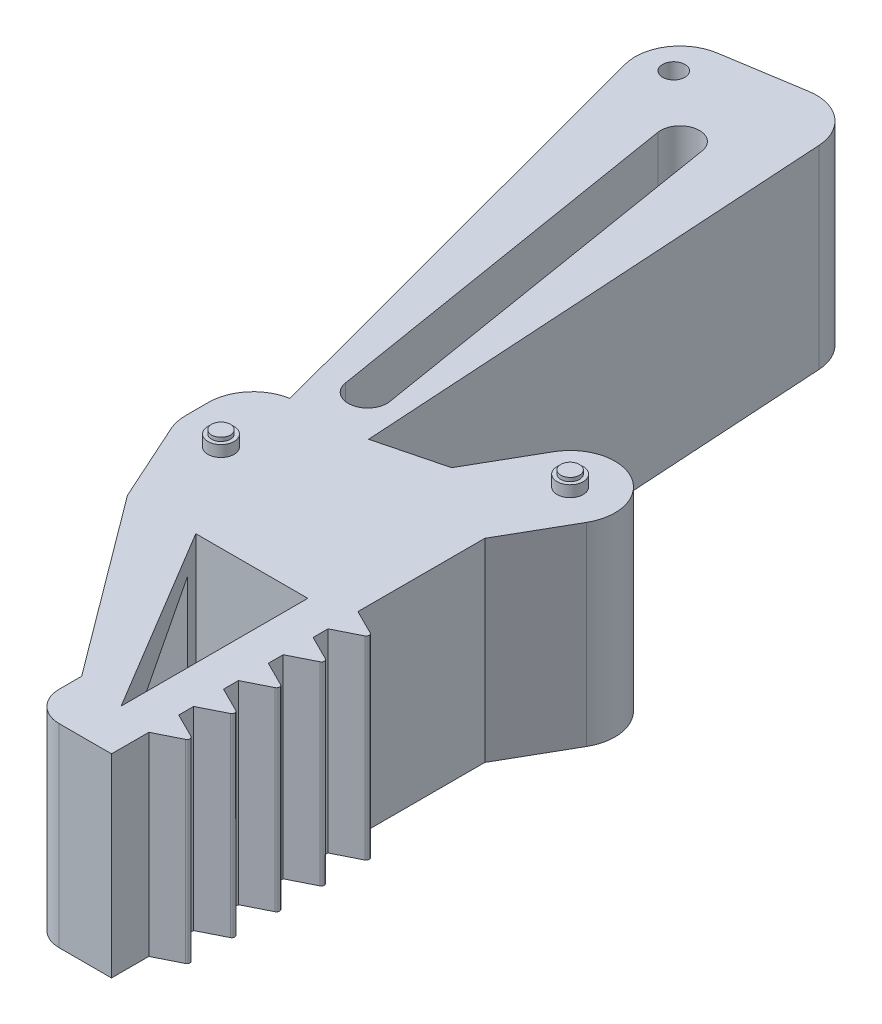
from build123d import *

# Parameters (mm, degrees)
BOSS_EXTRUDE1_DEPTH = 13
CUT_EXTRUDE1_DEPTH  = 26
BOSS_EXTRUDE3_DEPTH = 26
LPATTERN1_COUNT     = 5
LPATTERN1_PITCH     = 6
FILLET1_R           = 6
FILLET2_R           = 0.4
FILLET3_R           = 0.4
FILLET4_R           = 0.4
FILLET5_R           = 0.4
FILLET6_R           = 0.4
FILLET7_R           = 6
FILLET8_R           = 4
SKETCH4_R           = 1.5
CUT_EXTRUDE2_DEPTH  = 26
CUT_EXTRUDE3_DEPTH  = 7
SKETCH6_R           = 1.75
BOSS_EXTRUDE4_DEPTH = 1.5
SKETCH7_R           = 1.25
BOSS_EXTRUDE5_DEPTH = 0.5
CUT_EXTRUDE7_DEPTH  = 10


with BuildPart() as part:
    # Sketch1 → Boss-Extrude1 (new, symmetric)
    with BuildSketch(Plane(origin=(0, 0, 0), x_dir=(1, 0, 0), z_dir=(0, 1, 0))):
        Polygon((-26.537476469, 34.756624027), (-8.502257827, -32.880132907), (1.497742173, -32.349622066), (-2.834075277, 38.51810936), align=None)
        with BuildLine():
            Line((20.769613605, -36.051991051), (25.741983559, -27.375843459))
            ThreePointArc((25.741983559, -27.375843459), (23.519716976, -19.186732931), (15.330606448, -21.408999514))
            Line((15.330606448, -21.408999514), (10.358236494, -30.085147107))
            Line((10.358236494, -30.085147107), (1.497742173, -32.349622066))
            Line((1.497742173, -32.349622066), (-13.502257827, -33.145388327))
            Line((-13.502257827, -33.145388327), (-13.502257827, -43.145388327))
            Line((-13.502257827, -43.145388327), (-8.151905345, -54.993330272))
            Line((-8.151905345, -54.993330272), (9.769613605, -79.051991051))
            Line((9.769613605, -79.051991051), (9.769613605, -86.051991051))
            Line((9.769613605, -86.051991051), (20.769613605, -86.051991051))
            Line((20.769613605, -86.051991051), (20.769613605, -36.051991051))
        make_face()
    extrude(amount=BOSS_EXTRUDE1_DEPTH, both=True)

    # Sketch2 → Cut-Extrude1 (cut)
    with BuildSketch(Plane(origin=(0, 13, 0), x_dir=(1, 0, 0), z_dir=(0, 1, 0))):
        Polygon((0.878679347, -54.871314491), (15.878679347, -54.871314491), (15.878679347, -79.871314491), align=None)
    extrude(amount=-CUT_EXTRUDE1_DEPTH, mode=Mode.SUBTRACT)

    # Sketch3 → Boss-Extrude3 (add)
    with BuildSketch(Plane(origin=(0, 13, 0), x_dir=(1, 0, 0), z_dir=(0, 1, 0))):
        Polygon((20.769613605, -77.051991051), (20.769613605, -79.051991051), (24.769613605, -79.051991051), align=None)
        Polygon((20.769613605, -79.051991051), (20.769613605, -81.051991051), (24.769613605, -79.051991051), align=None)
    boss_extrude3 = extrude(amount=-BOSS_EXTRUDE3_DEPTH)

    # LPattern1: Boss-Extrude3 ×5
    with Locations(*[(0, 0, -i * LPATTERN1_PITCH) for i in range(1, LPATTERN1_COUNT)]):
        add(boss_extrude3)

    # Fillet1
    fillet1_edges = [part.edges().sort_by_distance(p)[0] for p in [
        (-26.537476469, 0, -34.756624027),
        (-2.834075277, 0, -38.51810936),
    ]]
    fillet(fillet1_edges, radius=FILLET1_R)

    # Fillet2
    fillet2_edges = [part.edges().sort_by_distance(p)[0] for p in [
        (24.769613605, 0, 79.051991051),
    ]]
    fillet(fillet2_edges, radius=FILLET2_R)

    # Fillet3
    fillet3_edges = [part.edges().sort_by_distance(p)[0] for p in [
        (24.769613605, 0, 73.051991051),
    ]]
    fillet(fillet3_edges, radius=FILLET3_R)

    # Fillet4
    fillet4_edges = [part.edges().sort_by_distance(p)[0] for p in [
        (24.769613605, 0, 67.051991051),
    ]]
    fillet(fillet4_edges, radius=FILLET4_R)

    # Fillet5
    fillet5_edges = [part.edges().sort_by_distance(p)[0] for p in [
        (24.769613605, 0, 61.051991051),
    ]]
    fillet(fillet5_edges, radius=FILLET5_R)

    # Fillet6
    fillet6_edges = [part.edges().sort_by_distance(p)[0] for p in [
        (24.769613605, 0, 55.051991051),
    ]]
    fillet(fillet6_edges, radius=FILLET6_R)

    # Fillet7
    # the kernel refuses this fillet: 6 mm, written as the material it takes off along each edge
    with BuildSketch(Plane(origin=(-13.502257827, -16.229856517, 43.145388327), x_dir=(0, 0, -1), z_dir=(0, 1, 0))) as fillet7_piece_1:
        with BuildLine():
            CenterArc((FILLET7_R * 0.215323767796, -FILLET7_R), FILLET7_R, 90, 24.303219814)
            Line((-FILLET7_R * 0.196241807704, -FILLET7_R * 0.0886198504117), (-FILLET7_R * 0.204473119214, -FILLET7_R * 0.0703922474199))
            Line((-FILLET7_R * 0.204473119214, -FILLET7_R * 0.0703922474199), (-FILLET7_R * 0.00430647535592, FILLET7_R * 0.02))
            Line((-FILLET7_R * 0.00430647535592, FILLET7_R * 0.02), (FILLET7_R * 0.215323767796, FILLET7_R * 0.02))
            Line((FILLET7_R * 0.215323767796, FILLET7_R * 0.02), (FILLET7_R * 0.215323767796, 0))
        make_face()
    extrude(amount=32.459713034, mode=Mode.SUBTRACT)
    with BuildSketch(Plane(origin=(-13.502257827, -27.127060907, 33.145388327), x_dir=(0.9985957546463174, 0, -0.052976587303748185), z_dir=(0, 1, 0))) as fillet7_piece_2_section:
        with BuildLine():
            CenterArc((5.692213138, -5.960748743), FILLET7_R, 96.557311778, 80.405931773)
            Line((-0.29936139, -5.642889219), (-0.419192881, -5.636532029))
            Line((-0.419192881, -5.636532029), (-0.119831491, 0.00635719))
            Line((-0.119831491, 0.00635719), (0, 0.12))
            ThreePointArc((0, 0.12), (2.50351555, 0.12), (4.993327459, 0.119214975))
            Line((4.993327459, 0.119214975), (5.0070311, 0))
        make_face()
    fillet7_piece_2 = extrude(amount=54.254121814, mode=Mode.PRIVATE)
    fillet7_piece_2 = split(fillet7_piece_2, bisect_by=Plane(origin=(-8.382183635, 0, 33.330442332), z_dir=(-0.9662393847687492, 0, 0.25764598060460653)), keep=Keep.TOP, mode=Mode.PRIVATE)
    add(fillet7_piece_2, mode=Mode.SUBTRACT)

    # Fillet8
    fillet8_edges = [part.edges().sort_by_distance(p)[0] for p in [
        (9.769613605, 0, 86.051991051),
    ]]
    fillet(fillet8_edges, radius=FILLET8_R)

    # Sketch4 → Cut-Extrude2 (cut)
    with BuildSketch(Plane(origin=(0, 13, 0), x_dir=(1, 0, 0), z_dir=(0, 1, 0))):
        with Locations(Location((-20.798923606, 30.81758039, 0), (0, 0, 270))):
            Circle(SKETCH4_R)
    extrude(amount=-CUT_EXTRUDE2_DEPTH, mode=Mode.SUBTRACT)

    # Sketch5 → Cut-Extrude3 (cut)
    with BuildSketch(Plane(origin=(-31.588699111, 0, 23.530714154), x_dir=(0.5973839650110779, 0, 0.8019553593234747), z_dir=(-0.8019553593234747, 0, 0.5973839650110779))):
        Polygon((67.232378401, 7.385302578), (46.232378401, 10.5), (46.232378401, -10), (67.232378401, -4.614697422), align=None)
    extrude(amount=-CUT_EXTRUDE3_DEPTH, mode=Mode.SUBTRACT)

    # Sketch6 → Boss-Extrude4 (add)
    with BuildSketch(Plane(origin=(0, 13, 0), x_dir=(1, 0, 0), z_dir=(0, 1, 0))):
        with Locations(Location((20.536295004, -24.392421487, 0), (0, 0, 270))):
            Circle(SKETCH6_R)
        with Locations(Location((-7.502257827, -43.116441091, 0), (0, 0, 270))):
            Circle(SKETCH6_R)
    boss_extrude4 = extrude(amount=BOSS_EXTRUDE4_DEPTH)

    # Sketch7 → Boss-Extrude5 (add)
    with BuildSketch(Plane(origin=(0, 14.5, 0), x_dir=(1, 0, 0), z_dir=(0, 1, 0))):
        with Locations(Location((-7.502257827, -43.116441091, 0), (0, 0, 270))):
            Circle(SKETCH7_R)
        with Locations(Location((20.536295004, -24.392421487, 0), (0, 0, 270))):
            Circle(SKETCH7_R)
    boss_extrude5 = extrude(amount=BOSS_EXTRUDE5_DEPTH)

    # Sketch8 → Cut-Extrude7 (cut)
    with BuildSketch(Plane(origin=(0, 15, 0), x_dir=(1, 0, 0), z_dir=(0, 1, 0))):
        with BuildLine():
            Line((-9.614117845, 23.451702753), (-1.459254761, -26.548297247))
            ThreePointArc((-1.459254761, -26.548297247), (-3.602858696, -29.527400736), (-6.581962185, -27.3837968))
            Line((-6.581962185, -27.3837968), (-14.736825269, 22.6162032))
            ThreePointArc((-14.736825269, 22.6162032), (-12.593221334, 25.595306688), (-9.614117845, 23.451702753))
        make_face()
    cut_extrude7 = extrude(amount=-CUT_EXTRUDE7_DEPTH, mode=Mode.SUBTRACT)

    # Mirror1: Boss-Extrude4, Boss-Extrude5, Cut-Extrude7 across plane
    add(boss_extrude4.mirror(Plane.ZX))
    add(boss_extrude5.mirror(Plane.ZX))
    add(cut_extrude7.mirror(Plane.ZX), mode=Mode.SUBTRACT)


solid = part.part
